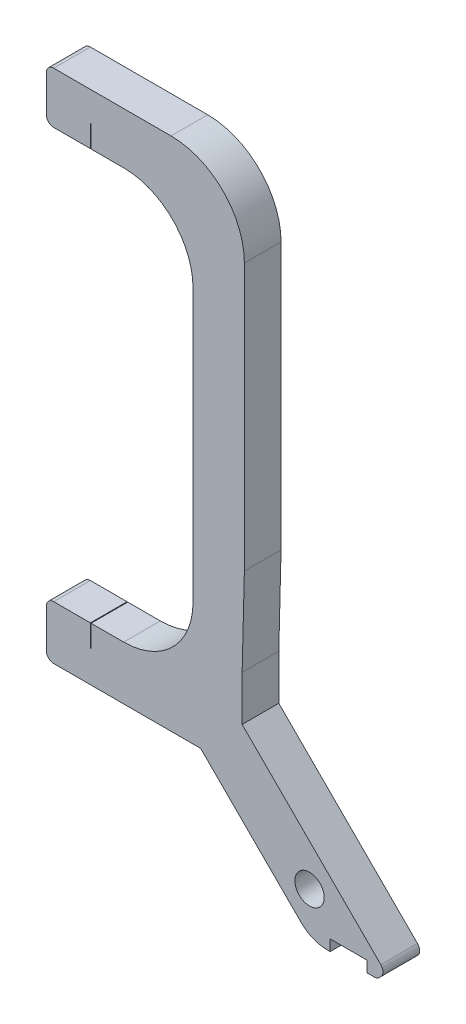
from build123d import *

# Parameters (mm, degrees)
SKETCH1_R           = 2
BOSS_EXTRUDE1_DEPTH = 5
SKETCH2_W           = 0.1
SKETCH2_H           = 5
CUT_EXTRUDE1_DEPTH  = 3
SKETCH3_W           = 0.1
SKETCH3_H           = 5
CUT_EXTRUDE2_DEPTH  = 3
SKETCH5_W           = 5
SKETCH5_H           = 5
CUT_EXTRUDE3_DEPTH  = 1.5


with BuildPart() as part:
    # Sketch1 → Boss-Extrude1 (new body)
    with BuildSketch(Plane.XY):
        with BuildLine():
            Line((1, 0), (17, 0))
            ThreePointArc((17, 0), (24.071067812, -2.928932188), (27, -10))
            Line((27, -10), (27, -10.164726931))
            Line((27, -10.164726931), (27, -46.377180563))
            Line((27, -46.377180563), (26.694646109, -58.493944172))
            Line((26.694646109, -58.493944172), (26.694646109, -64.399649032))
            Line((26.694646109, -64.399649032), (26.694646109, -64.648499642))
            Line((26.694646109, -64.648499642), (45.607665342, -83.561518875))
            ThreePointArc((45.607665342, -83.561518875), (45.900558561, -84.268625656), (45.607665342, -84.975732437))
            Line((45.607665342, -84.975732437), (45.406250284, -85.177147495))
            ThreePointArc((45.406250284, -85.177147495), (45.081826935, -85.393920246), (44.699143503, -85.470040714))
            Line((44.699143503, -85.470040714), (38.273546494, -85.470040714))
            ThreePointArc((38.273546494, -85.470040714), (36.360129332, -85.089438376), (34.738012588, -84.00557462))
            Line((34.738012588, -84.00557462), (21.037791859, -70.305353891))
            Line((21.037791859, -70.305353891), (16.801941123, -70.305353891))
            Line((16.801941123, -70.305353891), (1, -70.305353891))
            ThreePointArc((1, -70.305353891), (0.292893219, -70.012460672), (0, -69.305353891))
            Line((0, -69.305353891), (0, -64))
            ThreePointArc((0, -64), (0.292893219, -63.292893219), (1, -63))
            Line((1, -63), (10.539737479, -63))
            ThreePointArc((10.539737479, -63), (17.229153259, -60.229153259), (20, -53.539737479))
            Line((20, -53.539737479), (20, -16.460262521))
            ThreePointArc((20, -16.460262521), (17.229153259, -9.770846741), (10.539737479, -7))
            Line((10.539737479, -7), (1, -7))
            ThreePointArc((1, -7), (0.292893219, -6.707106781), (0, -6))
            Line((0, -6), (0, -1))
            ThreePointArc((0, -1), (0.292893219, -0.292893219), (1, 0))
        make_face()
        with Locations((35.887034264, -79.497742046)):
            Circle(SKETCH1_R, mode=Mode.SUBTRACT)
    extrude(amount=BOSS_EXTRUDE1_DEPTH)

    # Sketch2 → Cut-Extrude1 (cut)
    with BuildSketch(Plane(origin=(0, -63, 0), x_dir=(1, 0, 0), z_dir=(0, 1, 0))):
        with Locations((6.05, -2.5)):
            Rectangle(SKETCH2_W, SKETCH2_H)
    extrude(amount=-CUT_EXTRUDE1_DEPTH, mode=Mode.SUBTRACT)

    # Sketch3 → Cut-Extrude2 (cut)
    with BuildSketch(Plane.XZ.offset(7)):
        with Locations((6.05, 2.5)):
            Rectangle(SKETCH3_W, SKETCH3_H)
    extrude(amount=-CUT_EXTRUDE2_DEPTH, mode=Mode.SUBTRACT)

    # Sketch5 → Cut-Extrude3 (cut)
    with BuildSketch(Plane.XZ.offset(85.470040714)):
        with Locations((41.199143503, 2.5)):
            Rectangle(SKETCH5_W, SKETCH5_H)
    extrude(amount=-CUT_EXTRUDE3_DEPTH, mode=Mode.SUBTRACT)


solid = part.part
